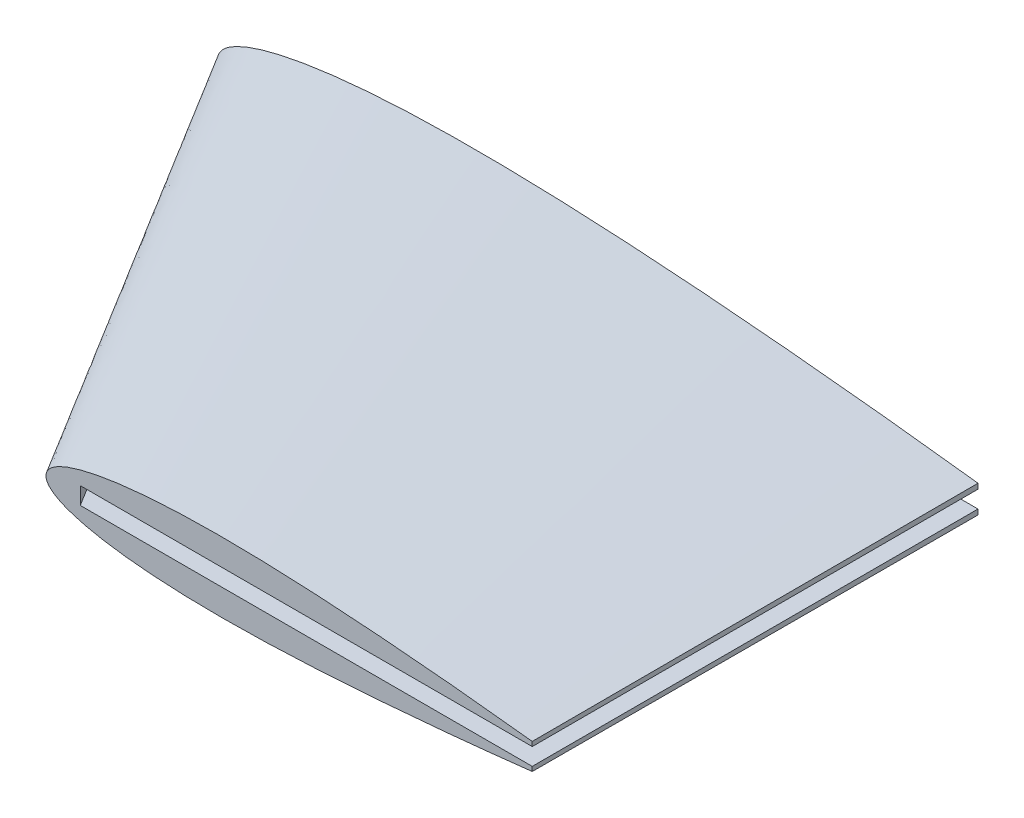
from build123d import *

# Parameters (mm, degrees)
CUT_EXTRUDE1_DEPTH      = 1.5875
CUT_EXTRUDE2_DEPTH      = 171.140492152
CUT_EXTRUDE2_DEPTH_BACK = 171.140492152
SKETCH4_W               = 7.62
SKETCH4_H               = 82.55


with BuildPart() as part:
    # Sketch2 → Loft1 section 0
    with BuildSketch(Plane.XY):
        with BuildLine():
            Line((158.75, 0.200025), (158.75, -0.200025))
            add(Edge.make_bspline(
                [(158.75, 0.200025), (158.71909688, 0.204365688), (158.595595465, 0.221712837), (158.102696889, 0.290649403), (157.364842188, 0.393694763), (156.38355217, 0.529022466), (155.376652322, 0.667459169), (154.192196316, 0.828770788), (152.832991405, 1.011912525), (151.302256438, 1.216101224), (149.603549234, 1.439870927), (147.740827831, 1.682170523), (145.718404099, 1.941055093), (142.716917091, 2.319885168), (139.518923315, 2.713029635), (136.131822158, 3.118533534), (133.38897405, 3.440574205), (130.519880389, 3.77022147), (127.531405341, 4.106633462), (124.430434802, 4.44739692), (121.224309535, 4.791596626), (117.920391998, 5.136772866), (114.526470196, 5.482285985), (111.050429063, 5.825471695), (107.500441749, 6.165252137), (103.884751972, 6.499267388), (100.211794247, 6.826425421), (96.490169401, 7.144021673), (92.728550301, 7.450635568), (88.93576994, 7.74430902), (85.12063813, 8.022684565), (81.292120592, 8.28401626), (77.459154452, 8.526216629), (72.366170003, 8.819846432), (67.296122641, 9.067564986), (61.036300651, 9.308612205), (56.108214782, 9.444356058), (51.250379716, 9.514935629), (47.700145953, 9.533534471), (44.223861063, 9.517092647), (40.82966086, 9.464870925), (37.525499043, 9.375291115), (34.319018969, 9.248749624), (31.217702542, 9.084337223), (28.228770019, 8.882514736), (25.359259662, 8.643324245), (22.615842908, 8.367200481), (20.004894178, 8.055190912), (17.532432729, 7.708563769), (15.204283091, 7.327965194), (13.025780945, 6.91529736), (11.001940076, 6.472111957), (9.137490367, 5.999911341), (7.436551668, 5.500810891), (5.902874549, 4.976468118), (4.539729658, 4.428693986), (3.349815404, 3.859068721), (2.335398727, 3.268778254), (1.497660875, 2.658823244), (0.838220584, 2.02820035), (0.358668112, 1.375123121), (0.065468974, 0.696399392), (-0.031912319, 0), (0.065468974, -0.696399392), (0.358668112, -1.375123121), (0.838220584, -2.02820035), (1.497660875, -2.658823244), (2.335398727, -3.268778254), (3.349815404, -3.859068721), (4.539729658, -4.428693986), (5.902874549, -4.976468118), (7.436551668, -5.500810891), (9.137490367, -5.999911341), (11.001940076, -6.472111957), (13.025780945, -6.91529736), (15.204283091, -7.327965194), (17.532432729, -7.708563769), (20.004894178, -8.055190912), (22.615842908, -8.367200481), (25.359259662, -8.643324245), (28.228770019, -8.882514736), (31.217702542, -9.084337223), (34.319018969, -9.248749624), (37.525499043, -9.375291115), (40.82966086, -9.464870925), (44.223861063, -9.517092647), (47.700145953, -9.533534471), (51.250379716, -9.514935629), (56.108214782, -9.444356058), (62.302399035, -9.273737594), (68.561385764, -9.009388302), (73.630611825, -8.746946582), (77.459154452, -8.526216629), (81.292120592, -8.28401626), (85.12063813, -8.022684565), (88.93576994, -7.74430902), (92.728550301, -7.450635568), (96.490169401, -7.144021673), (100.211794247, -6.826425421), (103.884751972, -6.499267388), (107.500441749, -6.165252137), (111.050429063, -5.825471695), (114.526470196, -5.482285985), (117.920391998, -5.136772866), (121.224309535, -4.791596626), (124.430434802, -4.44739692), (127.531405341, -4.106633462), (130.519880389, -3.77022147), (133.38897405, -3.440574205), (136.131822158, -3.118533534), (139.518923315, -2.713029635), (142.716917091, -2.319885168), (145.718404099, -1.941055093), (147.740827831, -1.682170523), (149.603549234, -1.439870927), (151.302256438, -1.216101224), (152.832991405, -1.011912525), (154.192196316, -0.828770788), (155.376652322, -0.667459169), (156.38355217, -0.529022466), (157.364842188, -0.393694763), (158.102696889, -0.290649403), (158.595595465, -0.221712837), (158.71909688, -0.204365688), (158.75, -0.200025)],
                knots=[0, 0, 0, 0, 0.000289201, 0.001155766, 0.004612322, 0.007193518, 0.010335793, 0.014031397, 0.018271612, 0.023045847, 0.028342901, 0.03415012, 0.04045376, 0.04723833, 0.062186613, 0.070313724, 0.078851908, 0.087780126, 0.097077521, 0.106722049, 0.116690868, 0.126960505, 0.137507218, 0.148306055, 0.159330765, 0.17055649, 0.181956531, 0.193504043, 0.205171367, 0.2169323, 0.228758169, 0.2406214, 0.252494936, 0.264350287, 0.287897994, 0.299535854, 0.322404759, 0.333584032, 0.344559266, 0.35530596, 0.365799778, 0.37601757, 0.3859373, 0.395537659, 0.404797976, 0.413698812, 0.422221441, 0.430349273, 0.438066019, 0.445356904, 0.452209372, 0.458611567, 0.464554044, 0.47002985, 0.475034902, 0.479569141, 0.483636857, 0.487250263, 0.490431338, 0.493218828, 0.495674086, 0.497891368, 0.5, 0.502108632, 0.504325914, 0.506781172, 0.509568662, 0.512749737, 0.516363143, 0.520430859, 0.524965098, 0.52997015, 0.535445956, 0.541388433, 0.547790628, 0.554643096, 0.561933981, 0.569650727, 0.577778559, 0.586301188, 0.595202024, 0.604462341, 0.6140627, 0.62398243, 0.634200222, 0.64469404, 0.655440734, 0.666415968, 0.677595241, 0.700464146, 0.723839427, 0.735649713, 0.747505064, 0.7593786, 0.771241831, 0.7830677, 0.794828633, 0.806495957, 0.818043469, 0.82944351, 0.840669235, 0.851693945, 0.862492782, 0.873039495, 0.883309132, 0.893277951, 0.902922479, 0.912219874, 0.921148092, 0.929686276, 0.937813387, 0.95276167, 0.95954624, 0.96584988, 0.971657099, 0.976954153, 0.981728388, 0.985968603, 0.989664207, 0.992806482, 0.995387678, 0.998844234, 0.999710799, 1, 1, 1, 1], degree=3))
        make_face()
    # Sketch1 → Loft1 section 1
    with BuildSketch(Plane.XY.offset(82.55)):
        with BuildLine():
            Line((158.75, -0.136017), (158.75, 0.136017))
            add(Edge.make_bspline(
                [(158.75, 0.136017), (158.728985878, 0.138968668), (158.645004916, 0.150764729), (158.309833885, 0.197641594), (157.808092688, 0.267712439), (157.140815475, 0.359735277), (156.456123579, 0.453872235), (155.650693495, 0.563564136), (154.726434155, 0.688100517), (153.685534378, 0.826948832), (152.530413479, 0.979112231), (151.263762925, 1.143875956), (149.888514788, 1.319917463), (147.847503622, 1.577521914), (145.672867854, 1.844860152), (143.369639068, 2.120602803), (141.504502354, 2.33959046), (139.553518664, 2.563750599), (137.521355632, 2.792510754), (135.412695665, 3.024229906), (133.232530484, 3.258285706), (130.985866559, 3.493005549), (128.677999733, 3.72795447), (126.314291763, 3.961320753), (123.90030039, 4.192371453), (121.441631341, 4.419501824), (118.944020088, 4.641969286), (116.413315193, 4.857934738), (113.855414205, 5.066432186), (111.276323559, 5.266130134), (108.682033928, 5.455425504), (106.078642002, 5.633131057), (103.472225028, 5.797827308), (100.008995602, 5.997495574), (96.561363396, 6.165944191), (92.304684442, 6.329856299), (88.953586052, 6.422162119), (85.650258207, 6.470156228), (83.236099248, 6.48280344), (80.872225523, 6.471623), (78.564169385, 6.436112229), (76.317339349, 6.375197958), (74.136932899, 6.289149744), (72.028037729, 6.177349312), (69.995563613, 6.04011002), (68.04429657, 5.877460486), (66.178773178, 5.689696327), (64.403328041, 5.47752982), (62.722054256, 5.241823363), (61.138912502, 4.983016332), (59.657531042, 4.702402205), (58.281319252, 4.401036131), (57.013493449, 4.079939712), (55.856855135, 3.740551406), (54.813954693, 3.38399832), (53.887016167, 3.01151191), (53.077874474, 2.62416673), (52.388071135, 2.222769213), (51.818409395, 1.807999806), (51.369989997, 1.379176238), (51.043894316, 0.935083722), (50.844518903, 0.473551587), (50.778299623, 0), (50.844518903, -0.473551587), (51.043894316, -0.935083722), (51.369989997, -1.379176238), (51.818409395, -1.807999806), (52.388071135, -2.222769213), (53.077874474, -2.62416673), (53.887016167, -3.01151191), (54.813954693, -3.38399832), (55.856855135, -3.740551406), (57.013493449, -4.079939712), (58.281319252, -4.401036131), (59.657531042, -4.702402205), (61.138912502, -4.983016332), (62.722054256, -5.241823363), (64.403328041, -5.47752982), (66.178773178, -5.689696327), (68.04429657, -5.877460486), (69.995563613, -6.04011002), (72.028037729, -6.177349312), (74.136932899, -6.289149744), (76.317339349, -6.375197958), (78.564169385, -6.436112229), (80.872225523, -6.471623), (83.236099248, -6.48280344), (85.650258207, -6.470156228), (88.953586052, -6.422162119), (93.165631344, -6.306141564), (97.421742319, -6.126384046), (100.868816041, -5.947923676), (103.472225028, -5.797827308), (106.078642002, -5.633131057), (108.682033928, -5.455425504), (111.276323559, -5.266130134), (113.855414205, -5.066432186), (116.413315193, -4.857934738), (118.944020088, -4.641969286), (121.441631341, -4.419501824), (123.90030039, -4.192371453), (126.314291763, -3.961320753), (128.677999733, -3.72795447), (130.985866559, -3.493005549), (133.232530484, -3.258285706), (135.412695665, -3.024229906), (137.521355632, -2.792510754), (139.553518664, -2.563750599), (141.504502354, -2.33959046), (143.369639068, -2.120602803), (145.672867854, -1.844860152), (147.847503622, -1.577521914), (149.888514788, -1.319917463), (151.263762925, -1.143875956), (152.530413479, -0.979112231), (153.685534378, -0.826948832), (154.726434155, -0.688100517), (155.650693495, -0.563564136), (156.456123579, -0.453872235), (157.140815475, -0.359735277), (157.808092688, -0.267712439), (158.309833885, -0.197641594), (158.645004916, -0.150764729), (158.728985878, -0.138968668), (158.75, -0.136017)],
                knots=[0, 0, 0, 0, 0.000289201, 0.001155766, 0.004612322, 0.007193518, 0.010335793, 0.014031397, 0.018271612, 0.023045847, 0.028342901, 0.03415012, 0.04045376, 0.04723833, 0.062186613, 0.070313724, 0.078851908, 0.087780126, 0.097077521, 0.106722049, 0.116690868, 0.126960505, 0.137507218, 0.148306055, 0.159330765, 0.17055649, 0.181956531, 0.193504043, 0.205171367, 0.2169323, 0.228758169, 0.2406214, 0.252494936, 0.264350287, 0.287897994, 0.299535854, 0.322404759, 0.333584032, 0.344559266, 0.35530596, 0.365799778, 0.37601757, 0.3859373, 0.395537659, 0.404797976, 0.413698812, 0.422221441, 0.430349273, 0.438066019, 0.445356904, 0.452209372, 0.458611567, 0.464554044, 0.47002985, 0.475034902, 0.479569141, 0.483636857, 0.487250263, 0.490431338, 0.493218828, 0.495674086, 0.497891368, 0.5, 0.502108632, 0.504325914, 0.506781172, 0.509568662, 0.512749737, 0.516363143, 0.520430859, 0.524965098, 0.52997015, 0.535445956, 0.541388433, 0.547790628, 0.554643096, 0.561933981, 0.569650727, 0.577778559, 0.586301188, 0.595202024, 0.604462341, 0.6140627, 0.62398243, 0.634200222, 0.64469404, 0.655440734, 0.666415968, 0.677595241, 0.700464146, 0.723839427, 0.735649713, 0.747505064, 0.7593786, 0.771241831, 0.7830677, 0.794828633, 0.806495957, 0.818043469, 0.82944351, 0.840669235, 0.851693945, 0.862492782, 0.873039495, 0.883309132, 0.893277951, 0.902922479, 0.912219874, 0.921148092, 0.929686276, 0.937813387, 0.95276167, 0.95954624, 0.96584988, 0.971657099, 0.976954153, 0.981728388, 0.985968603, 0.989664207, 0.992806482, 0.995387678, 0.998844234, 0.999710799, 1, 1, 1, 1], degree=3))
        make_face()
    loft()

    # Sketch3 → Cut-Extrude1 (cut, symmetric)
    with BuildSketch(Plane(origin=(0, 0, 0), x_dir=(1, 0, 0), z_dir=(0, 1, 0))):
        Polygon((158.75, 0), (6.35, 0), (57.15, -82.55), (158.75, -82.55), align=None)
    extrude(amount=CUT_EXTRUDE1_DEPTH, both=True, mode=Mode.SUBTRACT)

    # Sketch4 → Cut-Extrude2 (cut, two sides: drawn at the far end of the back side and taken through both)
    with BuildSketch(Plane(origin=(0, 0, 0), x_dir=(1, 0, 0), z_dir=(0, 1, 0)).offset(-CUT_EXTRUDE2_DEPTH_BACK)):
        with Locations((144.657192788, -41.275)):
            Rectangle(SKETCH4_W, SKETCH4_H)
    extrude(amount=CUT_EXTRUDE2_DEPTH + CUT_EXTRUDE2_DEPTH_BACK, mode=Mode.SUBTRACT)


solid = part.part
